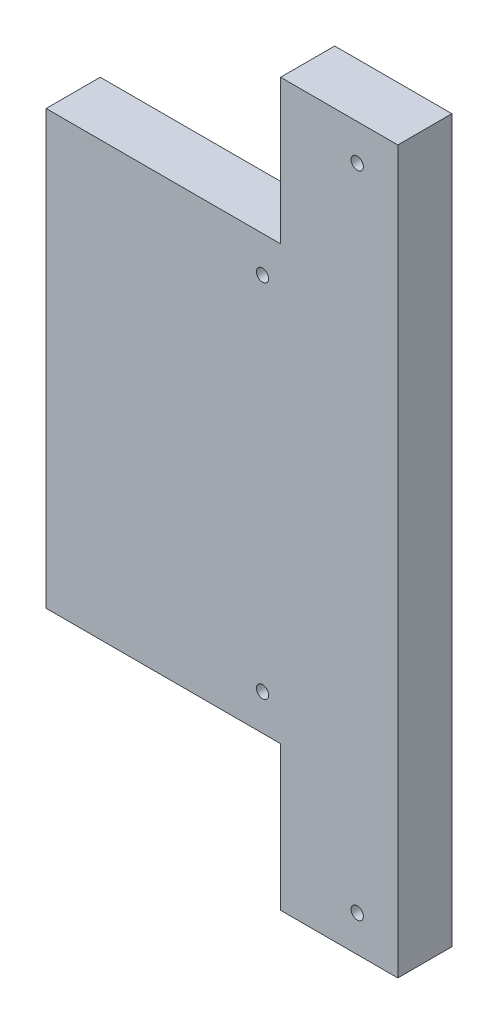
from build123d import *

# Parameters (mm, degrees)
BOSS_EXTRUDE1_DEPTH             = 15
SKETCH4_R                       = 1.7
CUT_EXTRUDE3_DEPTH              = 15
CBORE_FOR_M3_SBHCS1_D           = 3.4
CBORE_FOR_M3_SBHCS1_DEPTH       = 3.15
CBORE_FOR_M3_SBHCS1_CBORE_D     = 6.7
CBORE_FOR_M3_SBHCS1_CBORE_DEPTH = 1.65
CBORE_FOR_M3_SBHCS1_TIP         = 1.021463052
CBORE_FOR_M3_SBHCS2_D           = 3.4
CBORE_FOR_M3_SBHCS2_DEPTH       = 3.15
CBORE_FOR_M3_SBHCS2_CBORE_D     = 6.7
CBORE_FOR_M3_SBHCS2_CBORE_DEPTH = 1.65
CBORE_FOR_M3_SBHCS2_TIP         = 1.021463052
SKETCH7_W                       = 65
SKETCH7_H                       = 120
BOSS_EXTRUDE2_DEPTH             = 15
SKETCH9_W                       = 10
SKETCH9_H                       = 120
BOSS_EXTRUDE3_DEPTH             = 12
SKETCH10_W                      = 65
SKETCH10_H                      = 120
BOSS_EXTRUDE4_DEPTH             = 7
SKETCH11_R                      = 11
BOSS_EXTRUDE5_DEPTH             = 12
SKETCH13_W                      = 65
SKETCH13_H                      = 120
CUT_EXTRUDE4_DEPTH              = 19
SKETCH14_R                      = 1.7
CUT_EXTRUDE5_DEPTH              = 15
CBORE_FOR_M3_SBHCS3_D           = 3.4
CBORE_FOR_M3_SBHCS3_DEPTH       = 3.15
CBORE_FOR_M3_SBHCS3_CBORE_D     = 6.7
CBORE_FOR_M3_SBHCS3_CBORE_DEPTH = 1.65
CBORE_FOR_M3_SBHCS3_TIP         = 1.021463052


with BuildPart() as part:
    # Sketch1 → Boss-Extrude1 (new body)
    with BuildSketch(Plane(origin=(0, 0, 0), x_dir=(0, 1, 0), z_dir=(0, 0, 1))):
        Polygon((-100, 11.25), (-100, 21.25), (100, 21.25), (100, 11.25), (100, -11.25), (-100, -11.25), align=None)
    extrude(amount=BOSS_EXTRUDE1_DEPTH)

    # Sketch4 → Cut-Extrude3 (cut)
    with BuildSketch(Plane.XY.offset(15)):
        with Locations((0, 90)):
            Circle(SKETCH4_R)
        with Locations((0, -90)):
            Circle(SKETCH4_R)
    extrude(amount=-CUT_EXTRUDE3_DEPTH, mode=Mode.SUBTRACT)

    # CBORE for M3 SBHCS1
    with Locations(Plane(origin=(0, 90, 0), x_dir=(-1, 0, 0), z_dir=(0, 0, -1))):
        with Locations((0, 0)):
            CounterBoreHole(CBORE_FOR_M3_SBHCS1_D / 2, CBORE_FOR_M3_SBHCS1_CBORE_D / 2, CBORE_FOR_M3_SBHCS1_CBORE_DEPTH, depth=CBORE_FOR_M3_SBHCS1_DEPTH)
            with Locations((0, 0, -(CBORE_FOR_M3_SBHCS1_DEPTH + CBORE_FOR_M3_SBHCS1_TIP / 2))):  # 118° drill point
                Cone(0, CBORE_FOR_M3_SBHCS1_D / 2, CBORE_FOR_M3_SBHCS1_TIP, mode=Mode.SUBTRACT)

    # CBORE for M3 SBHCS2
    with Locations(Plane(origin=(0, -90, 0), x_dir=(-1, 0, 0), z_dir=(0, 0, -1))):
        with Locations((0, 0)):
            CounterBoreHole(CBORE_FOR_M3_SBHCS2_D / 2, CBORE_FOR_M3_SBHCS2_CBORE_D / 2, CBORE_FOR_M3_SBHCS2_CBORE_DEPTH, depth=CBORE_FOR_M3_SBHCS2_DEPTH)
            with Locations((0, 0, -(CBORE_FOR_M3_SBHCS2_DEPTH + CBORE_FOR_M3_SBHCS2_TIP / 2))):  # 118° drill point
                Cone(0, CBORE_FOR_M3_SBHCS2_D / 2, CBORE_FOR_M3_SBHCS2_TIP, mode=Mode.SUBTRACT)

    # Sketch7 → Boss-Extrude2 (add)
    with BuildSketch(Plane(origin=(0, 0, 0), x_dir=(1, 0, 0), z_dir=(0, 0, -1))):
        with Locations((-53.75, 0)):
            Rectangle(SKETCH7_W, SKETCH7_H)
    extrude(amount=-BOSS_EXTRUDE2_DEPTH)

    # Sketch9 → Boss-Extrude3 (add)
    with BuildSketch(Plane.XY.offset(15)):
        with Locations((-26.25, 0)):
            Rectangle(SKETCH9_W, SKETCH9_H)
    extrude(amount=BOSS_EXTRUDE3_DEPTH)

    # Sketch10 → Boss-Extrude4 (add)
    with BuildSketch(Plane.XY.offset(27)):
        with Locations((-53.75, 0)):
            Rectangle(SKETCH10_W, SKETCH10_H)
    extrude(amount=BOSS_EXTRUDE4_DEPTH)

    # Sketch11 → Boss-Extrude5 (add)
    with BuildSketch(Plane(origin=(0, 0, 27), x_dir=(1, 0, 0), z_dir=(0, 0, -1))):
        with Locations((-62.74, 0)):
            Circle(SKETCH11_R)
    extrude(amount=BOSS_EXTRUDE5_DEPTH)

    # Sketch13 → Cut-Extrude4 (cut)
    with BuildSketch(Plane.XY.offset(34)):
        with Locations((-53.75, 0)):
            Rectangle(SKETCH13_W, SKETCH13_H)
    extrude(amount=-CUT_EXTRUDE4_DEPTH, mode=Mode.SUBTRACT)

    # Sketch14 → Cut-Extrude5 (cut)
    with BuildSketch(Plane(origin=(0, 0, 0), x_dir=(1, 0, 0), z_dir=(0, 0, -1))):
        with Locations((-26.25, 50)):
            Circle(SKETCH14_R)
        with Locations((-26.25, -50)):
            Circle(SKETCH14_R)
    extrude(amount=-CUT_EXTRUDE5_DEPTH, mode=Mode.SUBTRACT)

    # CBORE for M3 SBHCS3
    with Locations(Plane(origin=(-26.25, -50, 0), x_dir=(-1, 0, 0), z_dir=(0, 0, -1))):
        with Locations((0, 0), (0, 100)):
            CounterBoreHole(CBORE_FOR_M3_SBHCS3_D / 2, CBORE_FOR_M3_SBHCS3_CBORE_D / 2, CBORE_FOR_M3_SBHCS3_CBORE_DEPTH, depth=CBORE_FOR_M3_SBHCS3_DEPTH)
            with Locations((0, 0, -(CBORE_FOR_M3_SBHCS3_DEPTH + CBORE_FOR_M3_SBHCS3_TIP / 2))):  # 118° drill point
                Cone(0, CBORE_FOR_M3_SBHCS3_D / 2, CBORE_FOR_M3_SBHCS3_TIP, mode=Mode.SUBTRACT)


solid = part.part
